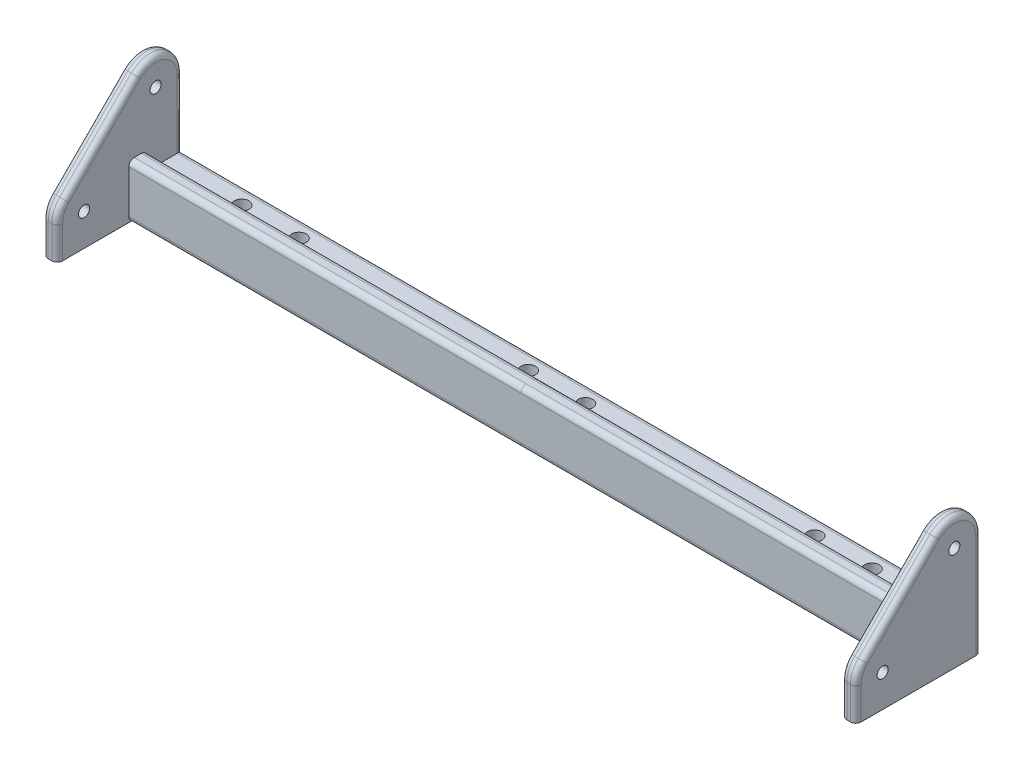
from build123d import *

# Parameters (mm, degrees)
BOSS_EXTRU_1_DEPTH      = 15
ESQUISSE2_R             = 1.55
BOSS_EXTRU_2_DEPTH      = 4
ESQUISSE5_R             = 2.05
ENL_V_MAT_EXTRU_3_DEPTH = 125.255784574
ESQUISSE7_W             = 109.5
ESQUISSE7_H             = 5
BOSS_EXTRU_3_DEPTH      = 5
CONG_1_R                = 1.5
CONG_1_OF_SYM_TRIE5_R   = 1.5


with BuildPart() as part:
    # Esquisse1 → Boss.-Extru.1 (new body)
    with BuildSketch(Plane.XY):
        Polygon((0, 10), (0, 5), (0, 0), (109.5, 0), (109.5, 10), align=None)
    boss_extru_1 = extrude(amount=BOSS_EXTRU_1_DEPTH)

    # Esquisse2 → Boss.-Extru.2 (add)
    with BuildSketch(Plane(origin=(109.5, 0, 0), x_dir=(0, 0, -1), z_dir=(1, 0, 0))):
        with BuildLine():
            ThreePointArc((0, 29), (-4.629874257, 35.929096494), (-12.803300859, 34.303300859))
            Line((-12.803300859, 34.303300859), (-32.803300859, 14.303300859))
            ThreePointArc((-32.803300859, 14.303300859), (-34.429096494, 11.870125743), (-35, 9))
            Line((-35, 9), (-35, 0))
            Line((-35, 0), (0, 0))
            Line((0, 0), (0, 29))
        make_face()
        with Locations((-27.5, 9)):
            Circle(ESQUISSE2_R, mode=Mode.SUBTRACT)
        with Locations((-7.5, 29)):
            Circle(ESQUISSE2_R, mode=Mode.SUBTRACT)
    boss_extru_2 = extrude(amount=BOSS_EXTRU_2_DEPTH)

    # Esquisse5 → Enlèv. mat.-Extru.3 (cut, through all)
    with BuildSketch(Plane.XZ):
        with Locations((8, 5)):
            Circle(ESQUISSE5_R)
        with Locations((72, 5)):
            Circle(ESQUISSE5_R)
        with Locations((88, 5)):
            Circle(ESQUISSE5_R)
    enl_v_mat_extru_3 = extrude(amount=-ENL_V_MAT_EXTRU_3_DEPTH, mode=Mode.SUBTRACT)

    # Esquisse7 → Boss.-Extru.3 (add)
    with BuildSketch(Plane(origin=(0, 10, 0), x_dir=(1, 0, 0), z_dir=(0, 1, 0))):
        with Locations((54.75, -12.5)):
            Rectangle(ESQUISSE7_W, ESQUISSE7_H)
    boss_extru_3 = extrude(amount=BOSS_EXTRU_3_DEPTH)

    # Congé1
    cong_1_edges = [part.edges().sort_by_distance(p)[0] for p in [
        (54.75, 10, 0),
        (54.75, 15, 15),
        (54.75, 15, 10),
        (54.75, 10, 10),
        (54.75, 0, 15),
        (113.5, 14.5, 0),
        (113.5, 35.929096494, 4.629874257),
        (113.5, 4.5, 35),
        (113.5, 11.870125743, 34.429096494),
        (109.5, 19.5, 0),
        (109.5, 35.929096494, 4.629874257),
        (109.5, 4.5, 35),
        (109.5, 11.870125743, 34.429096494),
        (113.5, 24.303300859, 22.803300859),
        (109.5, 24.303300859, 22.803300859),
    ]]
    fillet(cong_1_edges, radius=CONG_1_R)

    # Symétrie5: Boss.-Extru.1, Boss.-Extru.2, Enlèv. mat.-Extru.3, Boss.-Extru.3 across plane
    add(boss_extru_1.mirror(Plane(origin=(0, 5, 15), x_dir=(0, 0, 1), z_dir=(1, 0, 0))))
    add(boss_extru_2.mirror(Plane(origin=(0, 5, 15), x_dir=(0, 0, 1), z_dir=(1, 0, 0))))
    add(enl_v_mat_extru_3.mirror(Plane(origin=(0, 5, 15), x_dir=(0, 0, 1), z_dir=(1, 0, 0))), mode=Mode.SUBTRACT)
    add(boss_extru_3.mirror(Plane(origin=(0, 5, 15), x_dir=(0, 0, 1), z_dir=(1, 0, 0))))

    # Congé1 of Symétrie5
    cong_1_of_sym_trie5_edges = [part.edges().sort_by_distance(p)[0] for p in [
        (-54.75, 10, 0),
        (-54.75, 15, 15),
        (-54.75, 15, 10),
        (-54.75, 10, 10),
        (-54.75, 0, 15),
        (-113.5, 14.5, 0),
        (-113.5, 35.929096494, 4.629874257),
        (-113.5, 4.5, 35),
        (-113.5, 11.870125743, 34.429096494),
        (-109.5, 19.5, 0),
        (-109.5, 35.929096494, 4.629874257),
        (-109.5, 4.5, 35),
        (-109.5, 11.870125743, 34.429096494),
        (-113.5, 24.303300859, 22.803300859),
        (-109.5, 24.303300859, 22.803300859),
    ]]
    fillet(cong_1_of_sym_trie5_edges, radius=CONG_1_OF_SYM_TRIE5_R)


solid = part.part
